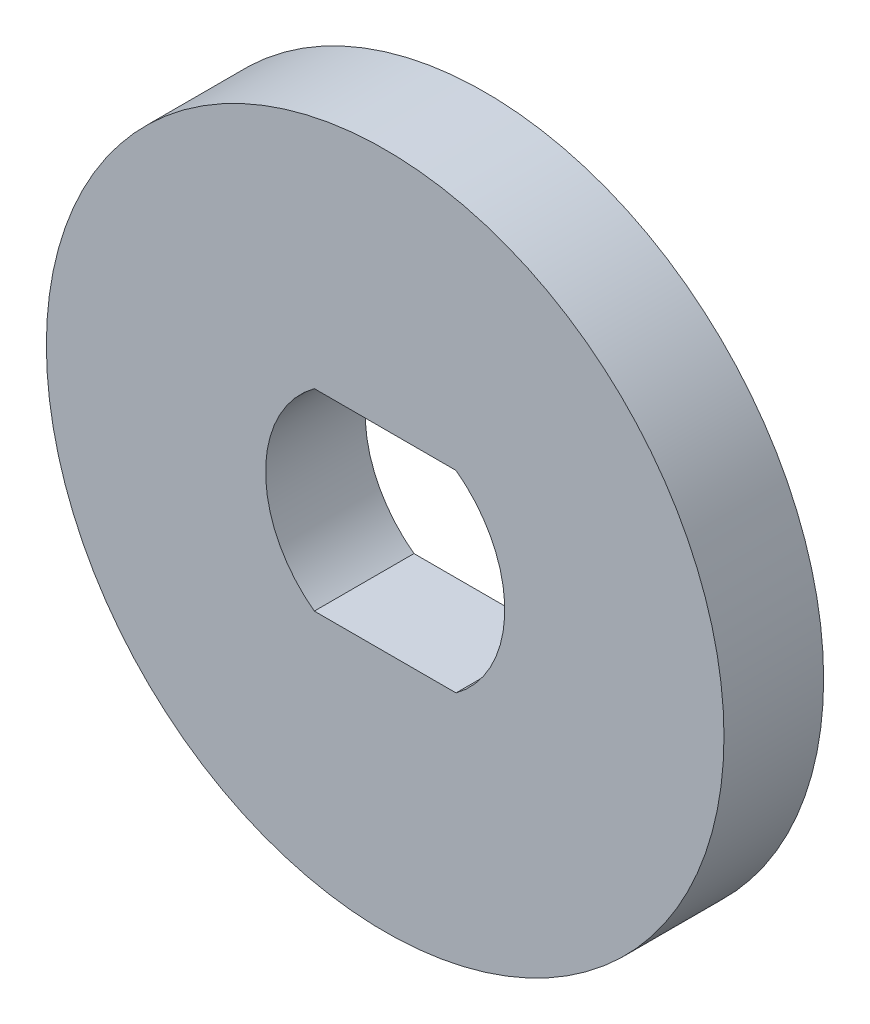
from build123d import *

# Parameters (mm, degrees)
SKETCH1_R           = 10.2
BOSS_EXTRUDE1_DEPTH = 3


with BuildPart() as part:
    # Sketch1 → Boss-Extrude1 (new body)
    with BuildSketch(Plane.XY):
        Circle(SKETCH1_R)
        with BuildLine():
            Line((-2.133072901, 2.9), (2.133072901, 2.9))
            ThreePointArc((2.133072901, 2.9), (3.6, 0), (2.133072901, -2.9))
            Line((2.133072901, -2.9), (-2.133072901, -2.9))
            ThreePointArc((-2.133072901, -2.9), (-3.6, 0), (-2.133072901, 2.9))
        make_face(mode=Mode.SUBTRACT)
    extrude(amount=BOSS_EXTRUDE1_DEPTH)


solid = part.part
